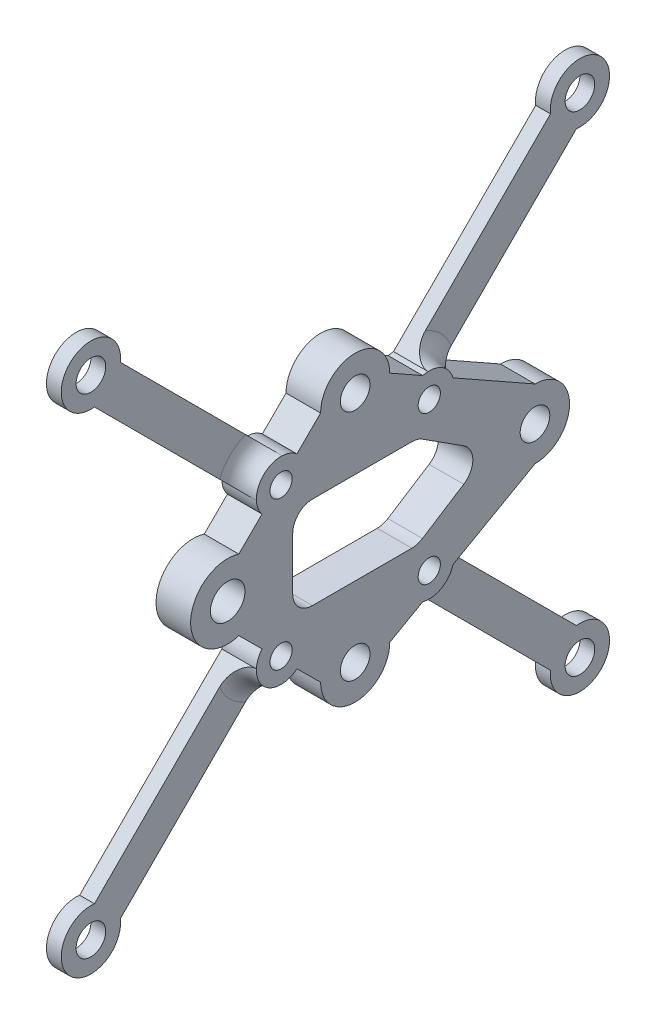
from build123d import *

# Parameters (mm, degrees)
SKETCH1_R             = 7.5
SKETCH1_R_2           = 3.5
BOSS_EXTRUDE1_DEPTH   = 13.6
SKETCH1_R_3           = 7
SKETCH1_R_4           = 3
BOSS_EXTRUDE1_2_DEPTH = 13.6
BOSS_EXTRUDE1_3_DEPTH = 13.6
BOSS_EXTRUDE1_4_DEPTH = 13.6
BOSS_EXTRUDE2_START   = -13.6
BOSS_EXTRUDE2_DEPTH   = 13.6
SKETCH3_R             = 2.25
CUT_EXTRUDE1_DEPTH    = 27.6
SKETCH4_R             = 5
SKETCH4_R_2           = 2.25
BOSS_EXTRUDE3_DEPTH   = 13.6
CUT_EXTRUDE2_DEPTH    = 32.6
FILLET1_R             = 4
BOSS_EXTRUDE4_START   = -3
BOSS_EXTRUDE4_DEPTH   = 3
FILLET2_R             = 4
CUT_EXTRUDE4_DEPTH    = 6.6
SKETCH9_R             = 6
SKETCH9_R_2           = 3
BOSS_EXTRUDE5_DEPTH   = 3


with BuildPart() as part:
    # Sketch1 → Boss-Extrude1 (new body)
    with BuildSketch(Plane.YZ):
        with Locations(Location((0, 25.806146942, 0), (0, 0, 270))):
            Circle(SKETCH1_R)
        with Locations(Location((0, 25.806146942, 0), (0, 0, 270))):
            Circle(SKETCH1_R_2, mode=Mode.SUBTRACT)
    extrude(amount=BOSS_EXTRUDE1_DEPTH)



with BuildPart() as body_2:
    # Sketch1 → Boss-Extrude1 2 (new body)
    with BuildSketch(Plane.YZ):
        with Locations(Location((-23.6, 0, 0), (0, 0, 270))):
            Circle(SKETCH1_R_3)
        with Locations(Location((-23.6, 0, 0), (0, 0, 270))):
            Circle(SKETCH1_R_4, mode=Mode.SUBTRACT)
    extrude(amount=BOSS_EXTRUDE1_2_DEPTH)


with BuildPart() as body_3:
    # Sketch1 → Boss-Extrude1 3 (new body)
    with BuildSketch(Plane.YZ):
        with Locations(Location((0, -36.4, 0), (0, 0, 270))):
            Circle(SKETCH1_R_3)
        with Locations(Location((0, -36.4, 0), (0, 0, 270))):
            Circle(SKETCH1_R_4, mode=Mode.SUBTRACT)
    extrude(amount=BOSS_EXTRUDE1_3_DEPTH)


with BuildPart() as body_4:
    # Sketch1 → Boss-Extrude1 4 (new body)
    with BuildSketch(Plane.YZ):
        with Locations(Location((23.6, 0, 0), (0, 0, 270))):
            Circle(SKETCH1_R_3)
        with Locations(Location((23.6, 0, 0), (0, 0, 270))):
            Circle(SKETCH1_R_4, mode=Mode.SUBTRACT)
    extrude(amount=BOSS_EXTRUDE1_4_DEPTH)


with BuildPart() as part_1:
    add(part.part)

    add(body_2.part)  # Boss-Extrude2 merges body 2

    add(body_3.part)  # Boss-Extrude2 merges body 3

    add(body_4.part)  # Boss-Extrude2 merges body 4
    # Sketch2 → Boss-Extrude2 (add)
    with BuildSketch(Plane.YZ.offset(13.6).offset(BOSS_EXTRUDE2_START)):
        with BuildLine():
            Line((-7.153153898, 23.551731428), (-23.6, 7))
            ThreePointArc((-23.6, 7), (-16.6, 0), (-23.6, -7))
            Line((-23.6, -7), (-7, -36.4))
            ThreePointArc((-7, -36.4), (0, -29.4), (7, -36.4))
            Line((7, -36.4), (23.6, -7))
            ThreePointArc((23.6, -7), (16.6, 0), (23.6, 7))
            Line((23.6, 7), (7.153153898, 23.551731428))
            ThreePointArc((7.153153898, 23.551731428), (0, 18.306146942), (-7.153153898, 23.551731428))
        make_face()
    extrude(amount=BOSS_EXTRUDE2_DEPTH)

    # Sketch3 → Cut-Extrude1 (cut)
    with BuildSketch(Plane.YZ.offset(13.6)):
        with Locations((15, 15)):
            Circle(SKETCH3_R)
        with Locations(Location((15, -15, 0), (0, 0, 270))):
            Circle(SKETCH3_R)
        with Locations(Location((-15, -15, 0), (0, 0, 270))):
            Circle(SKETCH3_R)
        with Locations((-15, 15)):
            Circle(SKETCH3_R)
    extrude(amount=-CUT_EXTRUDE1_DEPTH, mode=Mode.SUBTRACT)

    # Sketch4 → Boss-Extrude3 (add)
    # profile 1 of 4: a face of its own
    with BuildSketch(Plane.YZ.offset(13.6)):
        with Locations((-15, 15)):
            Circle(SKETCH4_R)
        with Locations(Location((-15, 15, 0), (0, 0, 270))):
            Circle(SKETCH4_R_2, mode=Mode.SUBTRACT)
    # profile 2 of 4: a face of its own
    with BuildSketch(Plane.YZ.offset(13.6)):
        with Locations((15, 15)):
            Circle(SKETCH4_R)
        with Locations(Location((15, 15, 0), (0, 0, 270))):
            Circle(SKETCH4_R_2, mode=Mode.SUBTRACT)
    # profile 3 of 4: a face of its own
    with BuildSketch(Plane.YZ.offset(13.6)):
        with Locations((15, -15)):
            Circle(SKETCH4_R)
        with Locations(Location((15, -15, 0), (0, 0, 270))):
            Circle(SKETCH4_R_2, mode=Mode.SUBTRACT)
    # profile 4 of 4: a face of its own
    with BuildSketch(Plane.YZ.offset(13.6)):
        with Locations((-15, -15)):
            Circle(SKETCH4_R)
        with Locations(Location((-15, -15, 0), (0, 0, 270))):
            Circle(SKETCH4_R_2, mode=Mode.SUBTRACT)
    extrude(amount=-BOSS_EXTRUDE3_DEPTH)

    # Sketch5 → Cut-Extrude2 (cut)
    with BuildSketch(Plane.YZ):
        Polygon((-9.332174862, -12.638356022), (0, -27.245238414), (9.332174862, -12.638356022), (9.332174862, 12.638356022), (-9.332174862, 12.638356022), align=None)
    extrude(amount=CUT_EXTRUDE2_DEPTH, mode=Mode.SUBTRACT)

    # Fillet1
    fillet1_edges = [part_1.edges().sort_by_distance(p)[0] for p in [
        (6.8, 0, -27.245238414),
        (6.8, 9.332174862, -12.638356022),
        (6.8, 9.332174862, 12.638356022),
        (6.8, -9.332174862, 12.638356022),
        (6.8, -9.332174862, -12.638356022),
    ]]
    fillet(fillet1_edges, radius=FILLET1_R)

    # Sketch6 → Boss-Extrude4 (add)
    with BuildSketch(Plane(origin=(0, 0, 0), x_dir=(0, -1, 0), z_dir=(-1, 0, 0)).offset(BOSS_EXTRUDE4_START)):
        with BuildLine():
            Line((-51.756049967, 47.522927219), (-52.113769773, 46.881179593))
            Line((-52.113769773, 46.881179593), (-19.994319481, 14.7617293))
            ThreePointArc((-19.994319481, 14.7617293), (-18.535533906, 18.535533906), (-14.7617293, 19.994319481))
            Line((-14.7617293, 19.994319481), (-46.881179593, 52.113769773))
            Line((-46.881179593, 52.113769773), (-47.376154339, 51.618795027))
            ThreePointArc((-47.376154339, 51.618795027), (-47.448391229, 47.306297603), (-51.756049967, 47.522927219))
        make_face()
        with BuildLine():
            Line((46.881179593, 52.113769773), (47.376154339, 51.618795027))
            ThreePointArc((47.376154339, 51.618795027), (47.376154339, 47.376154339), (51.618795027, 47.376154339))
            Line((51.618795027, 47.376154339), (52.113769773, 46.881179593))
            Line((52.113769773, 46.881179593), (19.994319481, 14.7617293))
            ThreePointArc((19.994319481, 14.7617293), (18.535533906, 18.535533906), (14.7617293, 19.994319481))
            Line((14.7617293, 19.994319481), (46.881179593, 52.113769773))
        make_face()
        with BuildLine():
            Line((46.881179593, -52.113769773), (47.376154339, -51.618795027))
            ThreePointArc((47.376154339, -51.618795027), (47.376154339, -47.376154339), (51.618795027, -47.376154339))
            Line((51.618795027, -47.376154339), (52.113769773, -46.881179593))
            Line((52.113769773, -46.881179593), (19.994319481, -14.7617293))
            ThreePointArc((19.994319481, -14.7617293), (19.060522514, -17.917560096), (16.367505015, -19.809358589))
            Line((16.367505015, -19.809358589), (15.721282674, -20.953872855))
            Line((15.721282674, -20.953872855), (46.881179593, -52.113769773))
        make_face()
        with BuildLine():
            Line((-52.113769773, -46.881179593), (-51.618795027, -47.376154339))
            ThreePointArc((-51.618795027, -47.376154339), (-47.376154339, -47.376154339), (-47.376154339, -51.618795027))
            Line((-47.376154339, -51.618795027), (-46.881179593, -52.113769773))
            Line((-46.881179593, -52.113769773), (-15.721282674, -20.953872855))
            Line((-15.721282674, -20.953872855), (-16.367505015, -19.809358589))
            ThreePointArc((-16.367505015, -19.809358589), (-19.060522514, -17.917560096), (-19.994319481, -14.7617293))
            Line((-19.994319481, -14.7617293), (-52.113769773, -46.881179593))
        make_face()
    extrude(amount=BOSS_EXTRUDE4_DEPTH)

    # Fillet2
    # the kernel refuses this fillet: 4 mm, written as the material it adds along each edge
    with BuildSketch(Plane(origin=(3, 15, -15), x_dir=(0, -0.9883550741062095, 0.15216519802014272), z_dir=(0, 0.15216519802014272, 0.9883550741062095))) as fillet2_piece_1_section:
        with BuildLine():
            CenterArc((5 + FILLET2_R, FILLET2_R), FILLET2_R, 180, 90)
            Line((5 + FILLET2_R, 0), (5, 0))
            Line((5, 0), (5, FILLET2_R))
        make_face()
    fillet2_piece_1 = revolve(axis=Axis((3, 15, -15), (1, 0, 0)), revolution_arc=306.108966915, mode=Mode.PRIVATE)
    fillet2_piece_1 = split(fillet2_piece_1, bisect_by=Plane(origin=(3.869561111, 16.288295425, -21.520885606), z_dir=(0, 0.7071067811865476, 0.7071067811865475)), keep=Keep.TOP, mode=Mode.PRIVATE)
    fillet2_piece_1 = split(fillet2_piece_1, bisect_by=Plane(origin=(3.869561111, 21.520885606, -16.288295425), z_dir=(0, -0.7071067811865476, -0.7071067811865476)), keep=Keep.TOP, mode=Mode.PRIVATE)
    add(fillet2_piece_1)
    with BuildSketch(Plane(origin=(3, 15, 15), x_dir=(0, -0.45980873999071614, -0.8880179742708759), z_dir=(0, -0.8880179742708759, 0.45980873999071614))) as fillet2_piece_2_section:
        with BuildLine():
            CenterArc((5 + FILLET2_R, FILLET2_R), FILLET2_R, 180, 90)
            Line((5 + FILLET2_R, 0), (5, 0))
            Line((5, 0), (5, FILLET2_R))
        make_face()
    fillet2_piece_2 = revolve(axis=Axis((3, 15, 15), (1, 0, 0)), revolution_arc=324.749533067, mode=Mode.PRIVATE)
    fillet2_piece_2 = split(fillet2_piece_2, bisect_by=Plane(origin=(3.903728463, 15.315269704, 15.337563929), z_dir=(0, 0.7093507229264948, 0.704855695787201)), keep=Keep.TOP, mode=Mode.PRIVATE)
    fillet2_piece_2 = split(fillet2_piece_2, bisect_by=Plane(origin=(3.903728463, 16.216872474, 21.449462655), z_dir=(0, 0.7071067811865475, -0.7071067811865477)), keep=Keep.TOP, mode=Mode.PRIVATE)
    fillet2_piece_2 = split(fillet2_piece_2, bisect_by=Plane(origin=(3.903728463, 21.449462655, 16.216872474), z_dir=(0, -0.7071067811865472, 0.7071067811865478)), keep=Keep.TOP, mode=Mode.PRIVATE)
    add(fillet2_piece_2)
    with BuildSketch(Plane(origin=(3, -15, -15), x_dir=(0, 0.45952627401725515, 0.8881641759763893), z_dir=(0, 0.8881641759763893, -0.45952627401725515))) as fillet2_piece_3_section:
        with BuildLine():
            CenterArc((5 + FILLET2_R, FILLET2_R), FILLET2_R, 180, 90)
            Line((5 + FILLET2_R, 0), (5, 0))
            Line((5, 0), (5, FILLET2_R))
        make_face()
    fillet2_piece_3 = revolve(axis=Axis((3, -15, -15), (1, 0, 0)), revolution_arc=306.108966915, mode=Mode.PRIVATE)
    fillet2_piece_3 = split(fillet2_piece_3, bisect_by=Plane(origin=(3.869559864, -21.520885794, -16.288295613), z_dir=(0, 0.7071067811865472, -0.707106781186548)), keep=Keep.TOP, mode=Mode.PRIVATE)
    fillet2_piece_3 = split(fillet2_piece_3, bisect_by=Plane(origin=(3.869559864, -16.288295613, -21.520885794), z_dir=(0, -0.7071067811865472, 0.7071067811865478)), keep=Keep.TOP, mode=Mode.PRIVATE)
    add(fillet2_piece_3)
    with BuildSketch(Plane(origin=(3, -15, 15), x_dir=(0, 0.45980873999071653, -0.8880179742708757), z_dir=(0, 0.8880179742708757, 0.45980873999071653))) as fillet2_piece_4_section:
        with BuildLine():
            CenterArc((5 + FILLET2_R, -FILLET2_R), FILLET2_R, 90, 90)
            Line((5 + FILLET2_R, 0), (5, 0))
            Line((5, 0), (5, -FILLET2_R))
        make_face()
    fillet2_piece_4 = revolve(axis=Axis((3, -15, 15), (-1, 0, 0)), revolution_arc=324.749533067, mode=Mode.PRIVATE)
    fillet2_piece_4 = split(fillet2_piece_4, bisect_by=Plane(origin=(3.903728463, -15.315269704, 15.337563929), z_dir=(0, -0.709350722926495, 0.7048556957872008)), keep=Keep.TOP, mode=Mode.PRIVATE)
    fillet2_piece_4 = split(fillet2_piece_4, bisect_by=Plane(origin=(3.903728463, -21.449462655, 16.216872474), z_dir=(0, 0.7071067811865475, 0.7071067811865477)), keep=Keep.TOP, mode=Mode.PRIVATE)
    fillet2_piece_4 = split(fillet2_piece_4, bisect_by=Plane(origin=(3.903728463, -16.216872474, 21.449462655), z_dir=(0, -0.7071067811865477, -0.7071067811865475)), keep=Keep.TOP, mode=Mode.PRIVATE)
    add(fillet2_piece_4)

    # Sketch7 → Cut-Extrude4 (cut)
    with BuildSketch(Plane.YZ.offset(13.6)):
        with BuildLine():
            Line((-18.836645052, 11.79373196), (-23.6, 7))
            ThreePointArc((-23.6, 7), (-30.6, 0), (-23.6, -7))
            Line((-23.6, -7), (-19.824466352, -13.686788509))
            ThreePointArc((-19.824466352, -13.686788509), (-19.353917023, -17.458334102), (-16.367505015, -19.809358589))
            Line((-16.367505015, -19.809358589), (-7, -36.4))
            ThreePointArc((-7, -36.4), (0, -43.4), (7, -36.4))
            Line((7, -36.4), (16.367505015, -19.809358589))
            ThreePointArc((16.367505015, -19.809358589), (19.353917023, -17.458334102), (19.824466352, -13.686788509))
            Line((19.824466352, -13.686788509), (23.6, -7))
            ThreePointArc((23.6, -7), (30.6, 0), (23.6, 7))
            Line((23.6, 7), (18.836645052, 11.79373196))
            ThreePointArc((18.836645052, 11.79373196), (18.546753615, 18.524278479), (11.818185898, 18.856949445))
            Line((11.818185898, 18.856949445), (7.153153898, 23.551731428))
            ThreePointArc((7.153153898, 23.551731428), (0, 33.306146942), (-7.153153898, 23.551731428))
            Line((-7.153153898, 23.551731428), (-11.818185898, 18.856949445))
            ThreePointArc((-11.818185898, 18.856949445), (-18.546753615, 18.524278479), (-18.836645052, 11.79373196))
        make_face()
    extrude(amount=-CUT_EXTRUDE4_DEPTH, mode=Mode.SUBTRACT)

    # Sketch9 → Boss-Extrude5 (add)
    # profile 1 of 4: a face of its own
    with BuildSketch(Plane.YZ.offset(3)):
        with Locations((-49.497474683, 49.497474683)):
            Circle(SKETCH9_R)
        with Locations(Location((-49.497474683, 49.497474683, 0), (0, 0, 90))):
            Circle(SKETCH9_R_2, mode=Mode.SUBTRACT)
    # profile 2 of 4: a face of its own
    with BuildSketch(Plane.YZ.offset(3)):
        with Locations((49.497474683, 49.497474683)):
            Circle(SKETCH9_R)
        with Locations(Location((49.497474683, 49.497474683, 0), (0, 0, 90))):
            Circle(SKETCH9_R_2, mode=Mode.SUBTRACT)
    # profile 3 of 4: a face of its own
    with BuildSketch(Plane.YZ.offset(3)):
        with Locations((49.497474683, -49.497474683)):
            Circle(SKETCH9_R)
        with Locations(Location((49.497474683, -49.497474683, 0), (0, 0, 90))):
            Circle(SKETCH9_R_2, mode=Mode.SUBTRACT)
    # profile 4 of 4: a face of its own
    with BuildSketch(Plane.YZ.offset(3)):
        with Locations((-49.497474683, -49.497474683)):
            Circle(SKETCH9_R)
        with Locations(Location((-49.497474683, -49.497474683, 0), (0, 0, 90))):
            Circle(SKETCH9_R_2, mode=Mode.SUBTRACT)
    extrude(amount=-BOSS_EXTRUDE5_DEPTH)


solid = part_1.part
